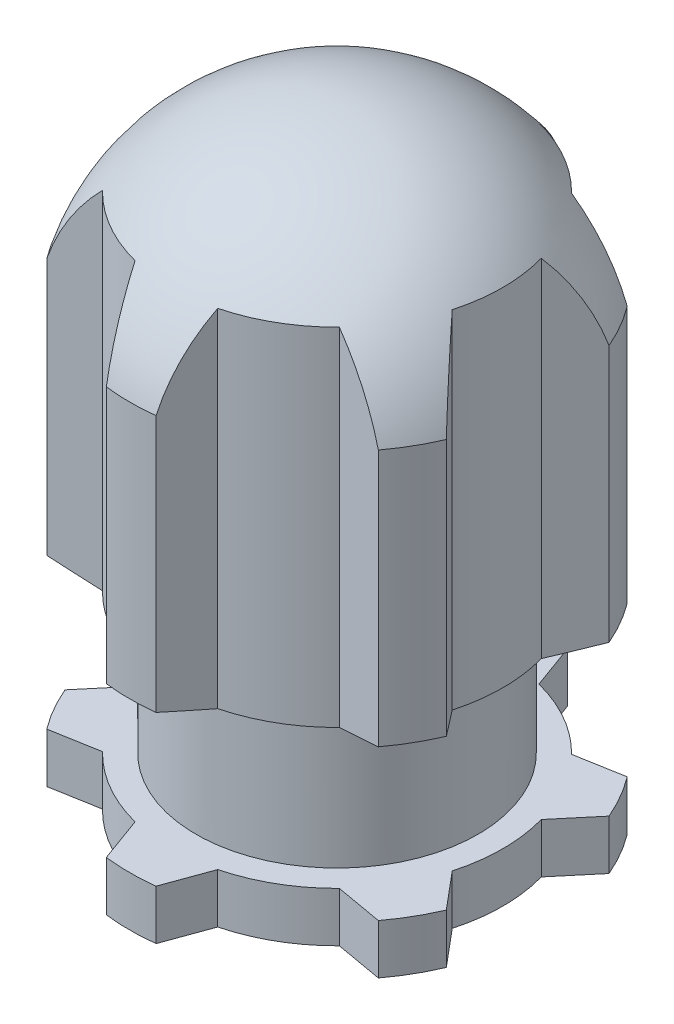
from build123d import *

# Parameters (mm, degrees)
EXTRUDE_1_DEPTH          = 34
EXTRUDE_1_DEPTH_BACK     = 3
EXTRUDE_START            = -3
EXTRUDE_2_DEPTH          = 37
PATTERN_CIRCULAR_1_COUNT = 6


# Read off the part's stored shape, not the designer's step: 切除-旋转-薄壁1
with BuildPart() as part:
    # 草图2 → 凸台-拉伸1 (new, two sides: drawn at the far end of the back side and taken through both)
    with BuildSketch(Plane(origin=(0, 0, 0), x_dir=(1, 0, 0), z_dir=(0, 1, 0)).offset(-EXTRUDE_1_DEPTH_BACK)):
        with BuildLine():
            ThreePointArc((-2.491861702, -9.684556018), (-1.255874162, -9.920825575), (0, -10))
            Line((0, -10), (0, 10))
            ThreePointArc((0, 10), (-9.920825575, 1.255874162), (-2.491861702, -9.684556018))
        make_face()
        with BuildLine():
            Line((0, 10), (0, -10))
            ThreePointArc((0, -10), (1.255874162, -9.920825575), (2.491861702, -9.684556018))
            ThreePointArc((2.491861702, -9.684556018), (7.903120175, -6.127045903), (10, 0))
            ThreePointArc((10, 0), (7.071067812, 7.071067812), (0, 10))
        make_face()
    extrude(amount=EXTRUDE_1_DEPTH + EXTRUDE_1_DEPTH_BACK)

    # 草图2<3> → 凸台-拉伸2 (add)
    with BuildSketch(Plane(origin=(0, 0, 0), x_dir=(1, 0, 0), z_dir=(0, 1, 0)).offset(EXTRUDE_START)):
        with BuildLine():
            ThreePointArc((-1.5, -12.409673646), (-0.751358578, -12.477397977), (0, -12.5))
            Line((0, -12.5), (0, -10))
            ThreePointArc((0, -10), (-1.255874162, -9.920825575), (-2.491861702, -9.684556018))
            Line((-2.491861702, -9.684556018), (-1.5, -12.409673646))
        make_face()
        with BuildLine():
            Line((0, -10), (0, -12.5))
            ThreePointArc((0, -12.5), (0.751358578, -12.477397977), (1.5, -12.409673646))
            Line((1.5, -12.409673646), (2.491861702, -9.684556018))
            ThreePointArc((2.491861702, -9.684556018), (1.255874162, -9.920825575), (0, -10))
        make_face()
    extrude_2 = extrude(amount=EXTRUDE_2_DEPTH)

    # 阵列(圆周)1: 凸台-拉伸2 ×6 about axis
    pattern_circular_1_axis = Axis((0, 0, 0), (0, 1, 0))
    for i in range(1, PATTERN_CIRCULAR_1_COUNT):
        add(extrude_2.rotate(pattern_circular_1_axis, i * 360 / PATTERN_CIRCULAR_1_COUNT))

    # 草图3 → 切除-旋转1 (revolve, cut)
    with BuildSketch(Plane(origin=(0, 0, 0), x_dir=(0, 0, -1), z_dir=(1, 0, 0)), mode=Mode.PRIVATE) as cut_revolve_1_sk:
        Polygon((-12.5, 0), (-8.5, 0), (-8.5, 8), (-12.5, 9.07179677), align=None)
    revolve(cut_revolve_1_sk.sketch.rotate(Axis((0, -3, 0), (0, 1, 0)), 353.107897421), axis=Axis((0, -3, 0), (0, 1, 0)), mode=Mode.SUBTRACT)

    # 切除-旋转-薄壁1 outline → 切除-旋转-薄壁1 (revolve, cut)
    with BuildSketch(Plane.XY):
        with BuildLine():
            ThreePointArc((0, 34), (7.828815855, 31.378325603), (12.500000004, 24.570714202))
            Line((12.500000004, 24.570714202), (12.500000004, 34))
            Line((12.500000004, 34), (0, 34))
        make_face()
    revolve(axis=Axis((0, 0, 0), (0, 1, 0)), mode=Mode.SUBTRACT)


solid = part.part
